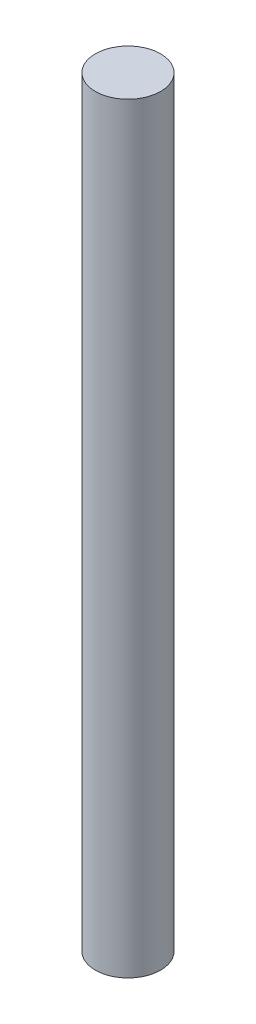
from build123d import *

# Parameters (mm, degrees)
SKETCH1_R           = 1.5
BOSS_EXTRUDE1_DEPTH = 35


with BuildPart() as part:
    # Sketch1 → Boss-Extrude1 (new body)
    with BuildSketch(Plane(origin=(0, 0, 0), x_dir=(1, 0, 0), z_dir=(0, 1, 0))):
        Circle(SKETCH1_R)
    extrude(amount=BOSS_EXTRUDE1_DEPTH)


solid = part.part
